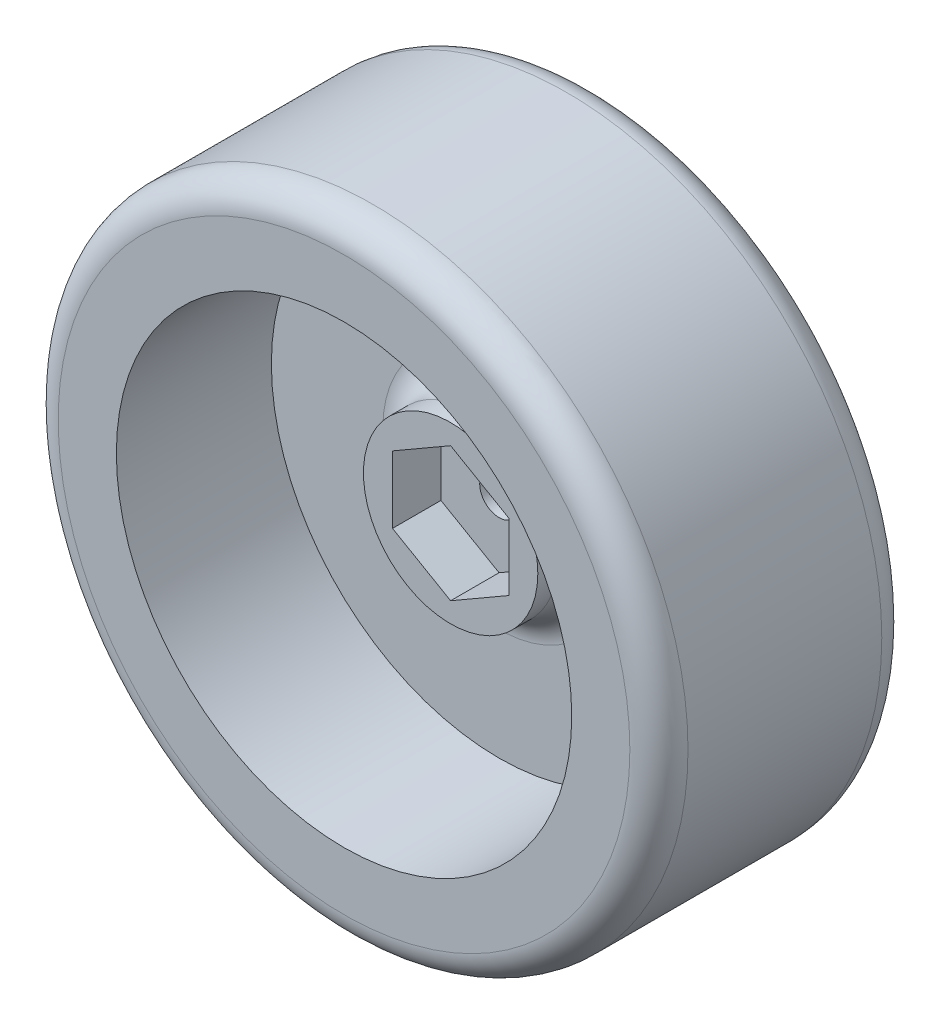
from build123d import *

# Parameters (mm, degrees)
SKETCH1_R           = 32.5
SKETCH1_R_2         = 2
BOSS_EXTRUDE1_DEPTH = 26
FILLET1_R           = 3
SKETCH2_R           = 23.5
CUT_EXTRUDE1_DEPTH  = 16
SKETCH3_R           = 9
BOSS_EXTRUDE2_DEPTH = 5
SKETCH4_R           = 7.5
CUT_EXTRUDE2_DEPTH  = 2
SKETCH5_R           = 5
CUT_EXTRUDE3_DEPTH  = 4
FILLET2_R           = 3


with BuildPart() as part:
    # Sketch1 → Boss-Extrude1 (new body)
    with BuildSketch(Plane.XY):
        Circle(SKETCH1_R)
        Circle(SKETCH1_R_2, mode=Mode.SUBTRACT)
    extrude(amount=BOSS_EXTRUDE1_DEPTH)

    # Fillet1
    fillet1_edges = [part.edges().sort_by_distance(p)[0] for p in [
        (-32.5, 0, 0),
        (-32.5, 0, 26),
    ]]
    fillet(fillet1_edges, radius=FILLET1_R)

    # Sketch2 → Cut-Extrude1 (cut)
    with BuildSketch(Plane.XY.offset(26)):
        Circle(SKETCH2_R)
    extrude(amount=-CUT_EXTRUDE1_DEPTH, mode=Mode.SUBTRACT)

    # Sketch3 → Boss-Extrude2 (add)
    with BuildSketch(Plane.XY.offset(10)):
        Circle(SKETCH3_R)
        Polygon((-6, -3.464101615), (-6, 3.464101615), (0, 6.92820323), (6, 3.464101615), (6, -3.464101615), (0, -6.92820323), align=None, mode=Mode.SUBTRACT)
    extrude(amount=BOSS_EXTRUDE2_DEPTH)

    # Sketch4 → Cut-Extrude2 (cut)
    with BuildSketch(Plane(origin=(0, 0, 0), x_dir=(-1, 0, 0), z_dir=(0, 0, -1))):
        Circle(SKETCH4_R)
    extrude(amount=-CUT_EXTRUDE2_DEPTH, mode=Mode.SUBTRACT)

    # Sketch5 → Cut-Extrude3 (cut)
    with BuildSketch(Plane(origin=(0, 0, 2), x_dir=(-1, 0, 0), z_dir=(0, 0, -1))):
        Circle(SKETCH5_R)
    extrude(amount=-CUT_EXTRUDE3_DEPTH, mode=Mode.SUBTRACT)

    # Fillet2
    fillet2_edges = [part.edges().sort_by_distance(p)[0] for p in [
        (-9, 0, 10),
    ]]
    fillet(fillet2_edges, radius=FILLET2_R)


solid = part.part
